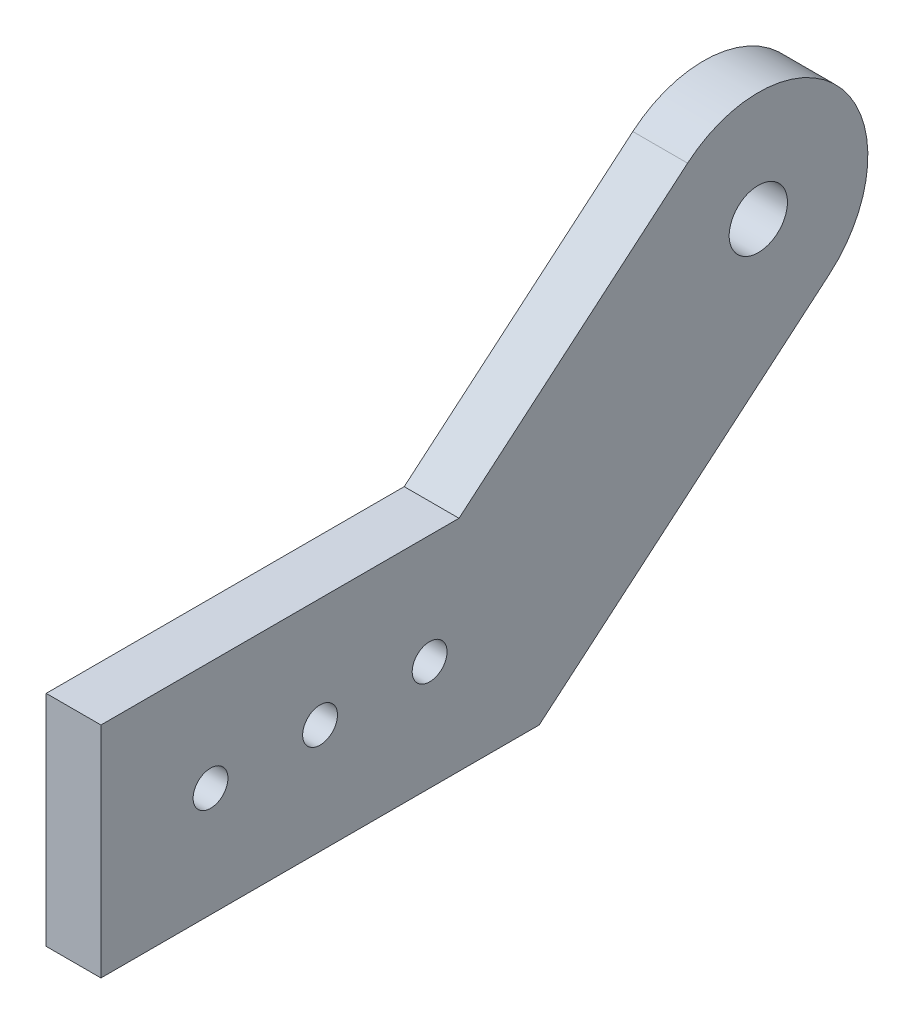
from build123d import *

# Parameters (mm, degrees)
BOSS_EXTRUDE1_DEPTH     = 6.35
F_10_32_TAPPED_HOLE1_D  = 4.0386
F_1_4_CLEARANCE_HOLE1_D = 6.7564


with BuildPart() as part:
    # Sketch1 → Boss-Extrude1 (new body)
    with BuildSketch(Plane(origin=(0, 0, 0), x_dir=(0, 0, -1), z_dir=(1, 0, 0))):
        with BuildLine():
            Line((50.8, 0), (84.398636272, 28.400909152))
            ThreePointArc((84.398636272, 28.400909152), (85.899090848, 46.298636272), (68.001363728, 47.799090848))
            Line((68.001363728, 47.799090848), (41.502954744, 25.4))
            Line((41.502954744, 25.4), (0, 25.4))
            Line((0, 25.4), (0, 0))
            Line((0, 0), (50.8, 0))
        make_face()
    extrude(amount=BOSS_EXTRUDE1_DEPTH)

    # #10-32 Tapped Hole1 (through all)
    with Locations(Plane(origin=(6.35, 0, 0), x_dir=(0, 0, -1), z_dir=(1, 0, 0))):
        with Locations((12.7, 12.7), (25.4, 12.7), (38.1, 12.7)):
            Hole(F_10_32_TAPPED_HOLE1_D / 2)

    # 1/4 Clearance Hole1 (through all)
    with Locations(Plane(origin=(6.35, 0, 0), x_dir=(0, 0, -1), z_dir=(1, 0, 0))):
        with Locations((76.2, 38.1)):
            Hole(F_1_4_CLEARANCE_HOLE1_D / 2)


solid = part.part
